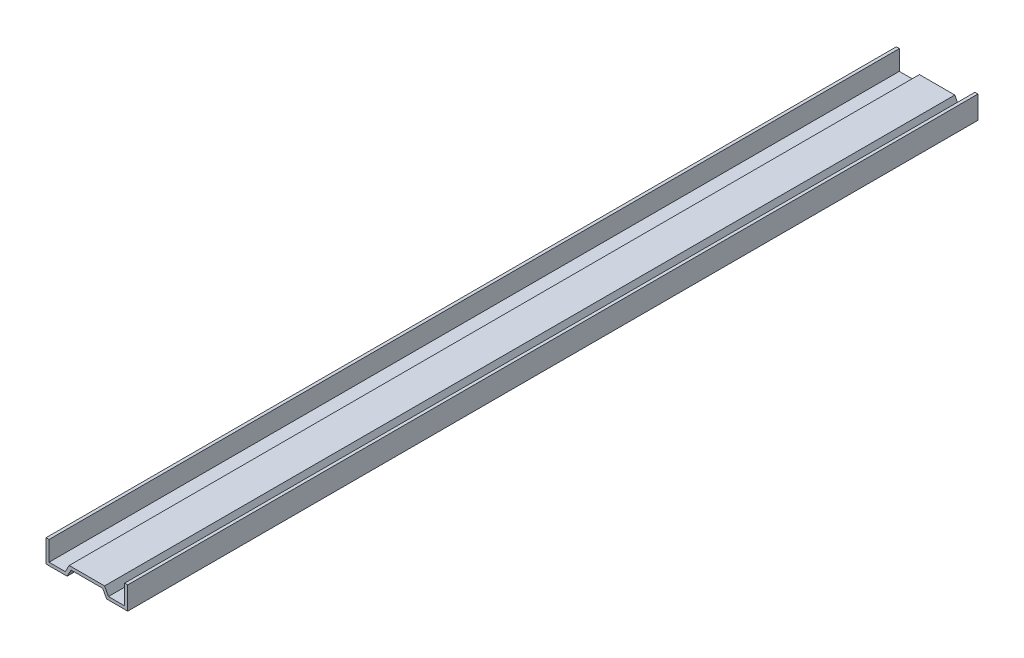
from build123d import *

# Parameters (mm, degrees)
BOSS_EXTRUDE1_DEPTH = 362


with BuildPart() as part:
    # Sketch1 → Boss-Extrude1 (new body)
    with BuildSketch(Plane.XY.offset(362)):
        Polygon((-9.180453293, -3.095455134), (-16.1, -3.095455134), (-16.1, 5.304544866), (-17.4, 5.304544866), (-17.4, -4.395455134), (-8.4, -4.395455134), (-6.749887033, -1.3), (6.750112967, -1.3), (8.4, -4.395455134), (17.4, -4.395455134), (17.4, 5.304544866), (16.1, 5.304544866), (16.1, -3.095455134), (9.18022736, -3.095455134), (7.530340327, 0), (-7.530340327, 0), align=None)
    extrude(amount=-BOSS_EXTRUDE1_DEPTH)


solid = part.part
